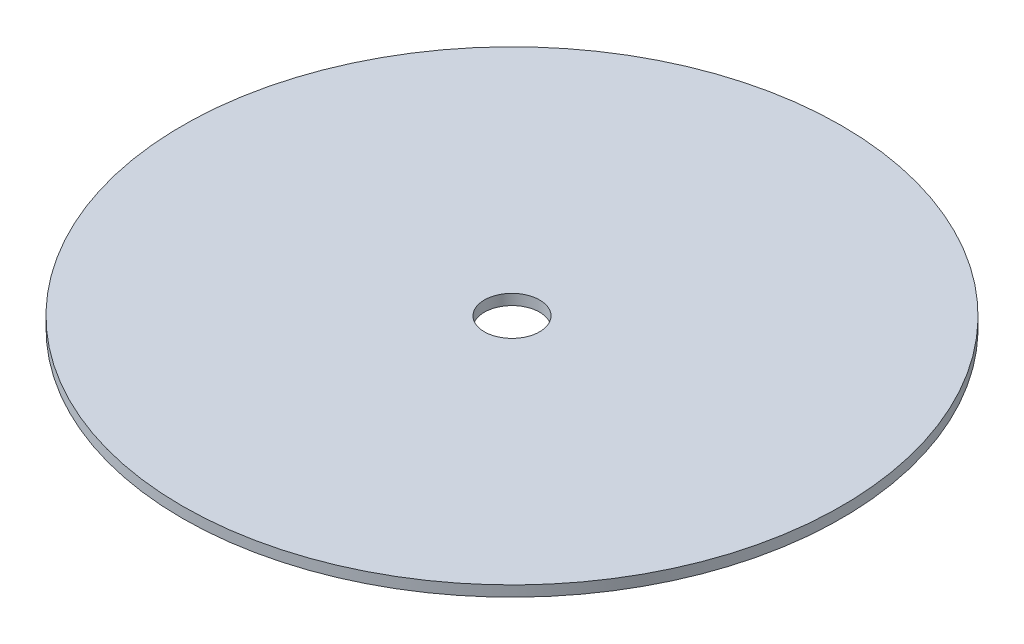
from build123d import *

# Parameters (mm, degrees)
SKETCH1_R           = 98.425
SKETCH1_R_2         = 8.248891971
BOSS_EXTRUDE1_DEPTH = 3.175


with BuildPart() as part:
    # Sketch1 → Boss-Extrude1 (new body)
    with BuildSketch(Plane(origin=(0, 0, 0), x_dir=(1, 0, 0), z_dir=(0, 1, 0))):
        Circle(SKETCH1_R)
        Circle(SKETCH1_R_2, mode=Mode.SUBTRACT)
    extrude(amount=BOSS_EXTRUDE1_DEPTH)


solid = part.part
